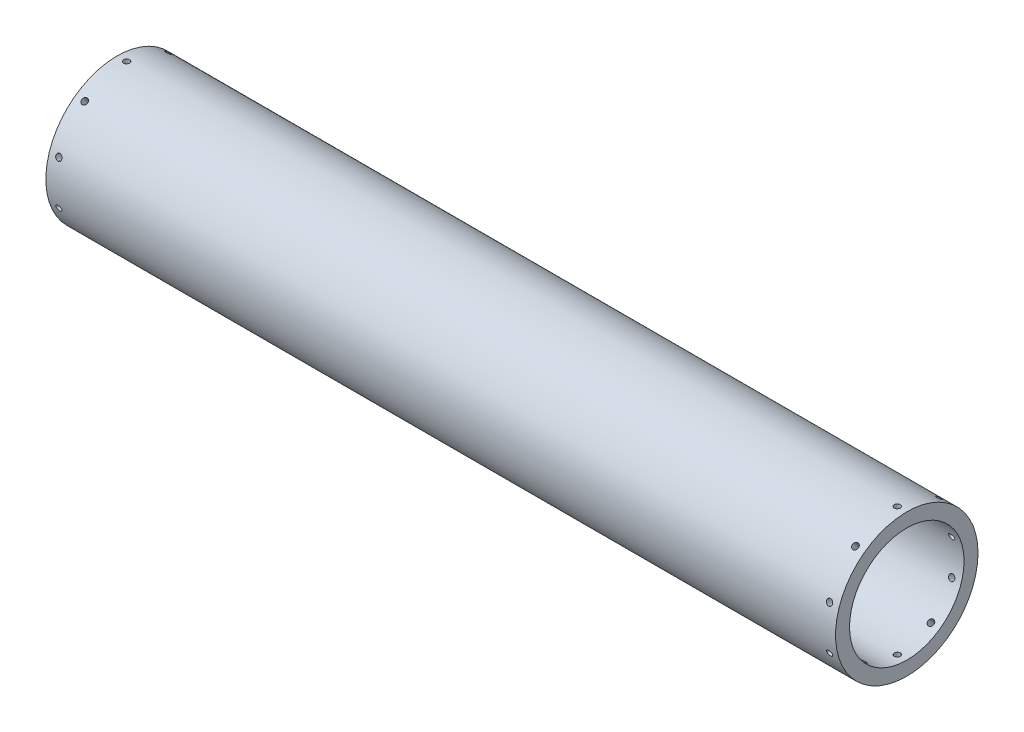
from build123d import *

# Parameters (mm, degrees)
SKETCH1_R           = 57.15
SKETCH1_R_2         = 45.9486
BOSS_EXTRUDE1_DEPTH = 633.73
SKETCH2_R           = 45.9486
SKETCH2_R_2         = 44.577
BOSS_EXTRUDE2_DEPTH = 88.9
SKETCH6_R           = 2.413
CUT_EXTRUDE1_DEPTH  = 15.24
CIRPATTERN1_COUNT   = 10
SKETCH7_R           = 2.413
CUT_EXTRUDE2_DEPTH  = 15.24
CIRPATTERN2_COUNT   = 10


with BuildPart() as part:
    # Sketch1 → Boss-Extrude1 (new body)
    with BuildSketch(Plane(origin=(0, 0, 0), x_dir=(0, 0, -1), z_dir=(1, 0, 0))):
        Circle(SKETCH1_R)
        Circle(SKETCH1_R_2, mode=Mode.SUBTRACT)
    extrude(amount=BOSS_EXTRUDE1_DEPTH)

    # Sketch2 → Boss-Extrude2 (add)
    with BuildSketch(Plane.ZY):
        Circle(SKETCH2_R)
        Circle(SKETCH2_R_2, mode=Mode.SUBTRACT)
    extrude(amount=-BOSS_EXTRUDE2_DEPTH)

    # Sketch6 → Cut-Extrude1 (cut)
    with BuildSketch(Plane(origin=(0, 57.15, 0), x_dir=(1, 0, 0), z_dir=(0, 1, 0))):
        with Locations((7.62, 0)):
            Circle(SKETCH6_R)
    cut_extrude1 = extrude(amount=-CUT_EXTRUDE1_DEPTH, mode=Mode.SUBTRACT)

    # CirPattern1: Cut-Extrude1 ×10 about axis
    cirpattern1_axis = Axis((0, 0, 0), (-1, 0, 0))
    for i in range(1, CIRPATTERN1_COUNT):
        add(cut_extrude1.rotate(cirpattern1_axis, i * 360 / CIRPATTERN1_COUNT), mode=Mode.SUBTRACT)

    # Sketch7 → Cut-Extrude2 (cut)
    with BuildSketch(Plane(origin=(0, 57.15, 0), x_dir=(1, 0, 0), z_dir=(0, 1, 0))):
        with Locations((626.11, 0)):
            Circle(SKETCH7_R)
    cut_extrude2 = extrude(amount=-CUT_EXTRUDE2_DEPTH, mode=Mode.SUBTRACT)

    # CirPattern2: Cut-Extrude2 ×10 about axis
    cirpattern2_axis = Axis((633.73, 0, 0), (1, 0, 0))
    for i in range(1, CIRPATTERN2_COUNT):
        add(cut_extrude2.rotate(cirpattern2_axis, i * 360 / CIRPATTERN2_COUNT), mode=Mode.SUBTRACT)


solid = part.part
